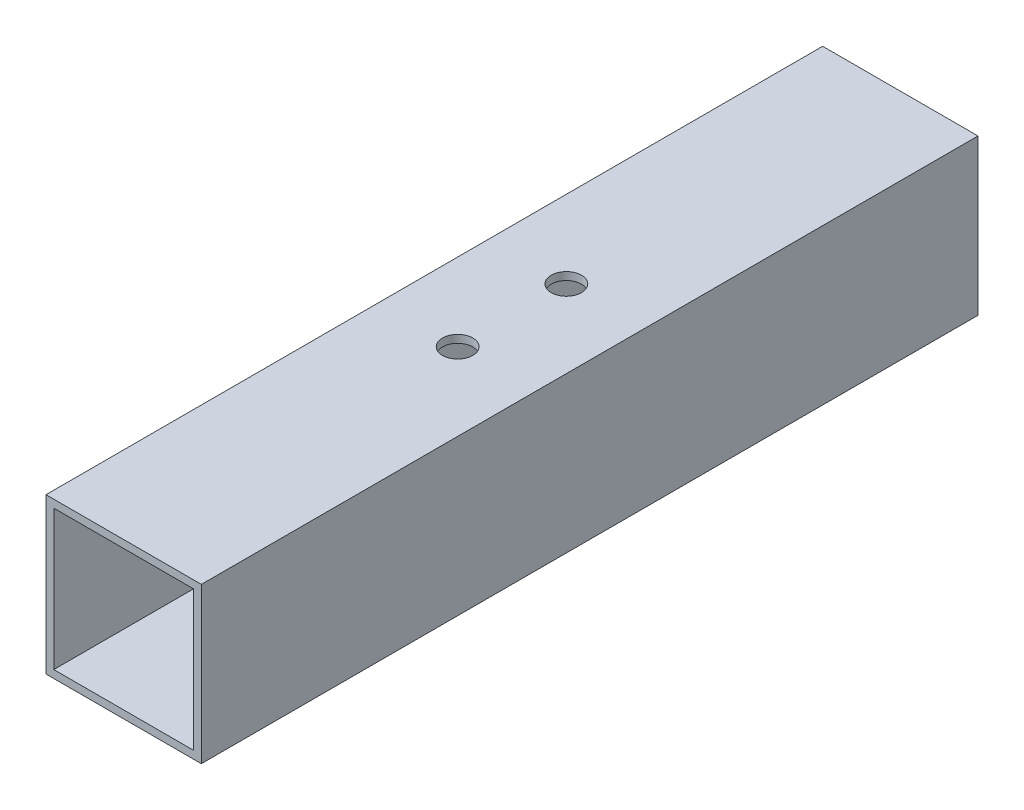
from build123d import *

# Parameters (mm, degrees)
SKETCH_1_W          = 20
SKETCH_1_H          = 20
SKETCH_1_W_2        = 18
SKETCH_1_H_2        = 18
EXTRUDE_1_DEPTH     = 100
SKETCH_3_R          = 1.95
CUT_EXTRUDE_2_DEPTH = 104.923048454


with BuildPart() as part:
    # 草图1 → 拉伸-薄壁1 (new body)
    with BuildSketch(Plane.XY):
        with Locations((10, -10)):
            Rectangle(SKETCH_1_W, SKETCH_1_H)
        with Locations((10, -10)):
            Rectangle(SKETCH_1_W_2, SKETCH_1_H_2, mode=Mode.SUBTRACT)
    extrude(amount=EXTRUDE_1_DEPTH)

    # 草图3 → 切除-拉伸2 (cut, through all)
    with BuildSketch(Plane.XZ.offset(20)):
        with Locations((10, 57)):
            Circle(SKETCH_3_R)
        with Locations((10, 43)):
            Circle(SKETCH_3_R)
    extrude(amount=-CUT_EXTRUDE_2_DEPTH, mode=Mode.SUBTRACT)


solid = part.part
